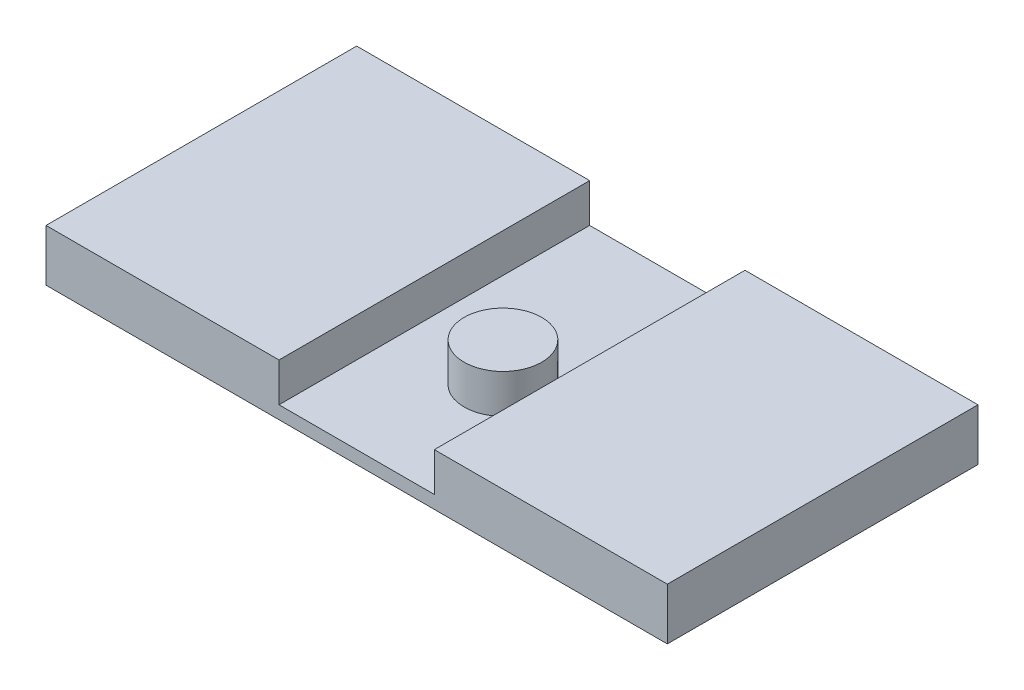
from build123d import *

# Parameters (mm, degrees)
SKETCH1_W           = 304.8
SKETCH1_H           = 152.4
BOSS_EXTRUDE1_DEPTH = 25.4
SKETCH2_W           = 76.2
SKETCH2_H           = 152.4
CUT_EXTRUDE1_DEPTH  = 19.05
SKETCH3_R           = 19.05
BOSS_EXTRUDE2_DEPTH = 19.05


with BuildPart() as part:
    # Sketch1 → Boss-Extrude1 (new body)
    with BuildSketch(Plane(origin=(0, 0, 0), x_dir=(1, 0, 0), z_dir=(0, 1, 0))):
        Rectangle(SKETCH1_W, SKETCH1_H)
    extrude(amount=BOSS_EXTRUDE1_DEPTH)

    # Sketch2 → Cut-Extrude1 (cut)
    with BuildSketch(Plane(origin=(0, 25.4, 0), x_dir=(-1, 0, 0), z_dir=(0, 1, 0))):
        Rectangle(SKETCH2_W, SKETCH2_H)
    extrude(amount=-CUT_EXTRUDE1_DEPTH, mode=Mode.SUBTRACT)

    # Sketch3 → Boss-Extrude2 (add)
    with BuildSketch(Plane(origin=(0, 6.35, 0), x_dir=(-1, 0, 0), z_dir=(0, 1, 0))):
        with Locations((-8.255, 12.7)):
            Circle(SKETCH3_R)
    extrude(amount=BOSS_EXTRUDE2_DEPTH)


solid = part.part
